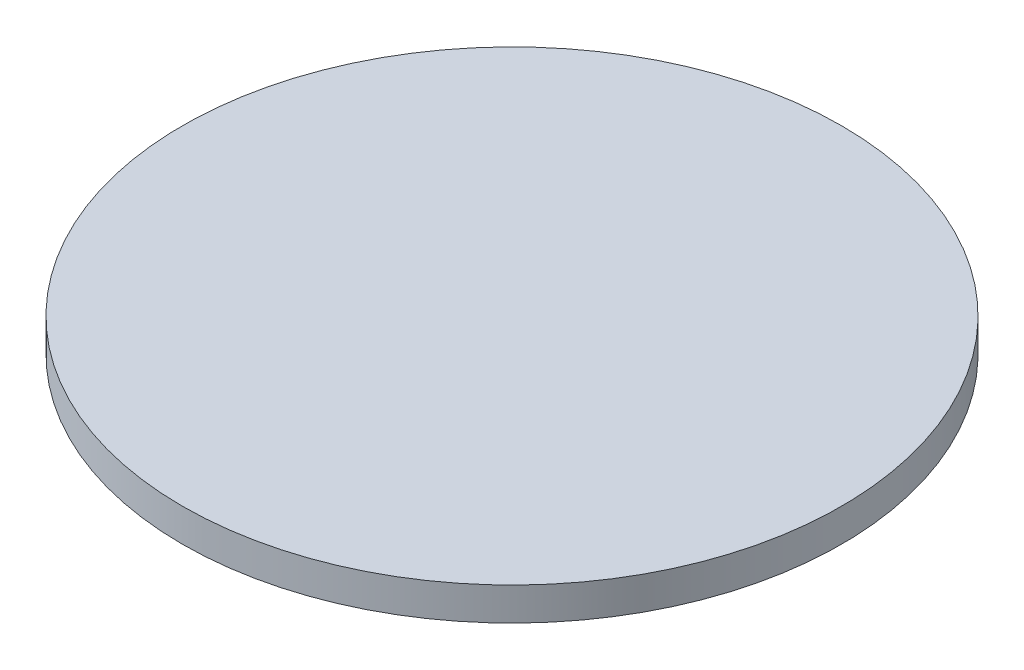
from build123d import *

# Parameters (mm, degrees)
EXTRUDE_1_DEPTH                      = 3
EXTRUDE_3_DEPTH                      = 8
CUT_EXTRUDE_3_DEPTH                  = 9
EXTRUDE_4_DEPTH                      = 3
EXTRUDE_START                        = -3
EXTRUDE_5_DEPTH                      = 3
CHAMFER_1_SIZE                       = 2
FILLET_1_R                           = 2
PATTERN_CIRCULAR_3_COUNT             = 3
PATTERN_CIRCULAR_3_COPY_1_DEPTH      = 9
PATTERN_CIRCULAR_3_COPY_2_DEPTH      = 9
CHAMFER_1_OF_PATTERN_CIRCULAR_3_SIZE = 2
FILLET_1_OF_PATTERN_CIRCULAR_3_R     = 2
SKETCH_8_R                           = 10
SKETCH_8_R_2                         = 7.5
EXTRUDE_6_DEPTH                      = 7
FILLET_2_R                           = 10
SKETCH_11_R                          = 100
EXTRUDE_7_DEPTH                      = 10


with BuildPart() as part:
    # 草圖1 → 填料-伸長1 (new body)
    with BuildSketch(Plane(origin=(0, 0, 0), x_dir=(1, 0, 0), z_dir=(0, 1, 0))):
        Polygon((0, 0), (-16.823237932, 62.785178709), (-62.785178709, -16.823237932), align=None)
        with BuildLine():
            Line((0, 65), (0, 0))
            Line((0, 0), (16.823237932, 62.785178709))
            ThreePointArc((16.823237932, 62.785178709), (8.484202494, 64.443915989), (0, 65))
        make_face()
        with BuildLine():
            Line((-16.823237932, 62.785178709), (0, 0))
            Line((0, 0), (0, 65))
            ThreePointArc((0, 65), (-8.484202494, 64.443915989), (-16.823237932, 62.785178709))
        make_face()
        Polygon((0, 0), (62.785178709, -16.823237932), (16.823237932, 62.785178709), align=None)
        with BuildLine():
            Line((0, 0), (45.961940777, -45.961940777))
            ThreePointArc((45.961940777, -45.961940777), (56.291651246, -32.5), (62.785178709, -16.823237932))
            Line((62.785178709, -16.823237932), (0, 0))
        make_face()
        Polygon((0, 0), (0, -45.961940777), (45.961940777, -45.961940777), align=None)
        Polygon((-45.961940777, -45.961940777), (0, -45.961940777), (0, 0), align=None)
        with BuildLine():
            Line((0, 0), (-62.785178709, -16.823237932))
            ThreePointArc((-62.785178709, -16.823237932), (-56.291651246, -32.5), (-45.961940777, -45.961940777))
            Line((-45.961940777, -45.961940777), (0, 0))
        make_face()
    extrude(amount=EXTRUDE_1_DEPTH)

    # 草圖2 → 填料-伸長3 (add)
    with BuildSketch(Plane.XZ):
        Polygon((12.862942044, -63.846336794), (20.783533819, -61.724020624), (18.195343368, -52.064762361), (10.274751593, -54.187078531), align=None)
        Polygon((-10.274751593, -54.187078531), (-18.195343368, -52.064762361), (-20.783533819, -61.724020624), (-12.862942044, -63.846336794), align=None)
    extrude_3 = extrude(amount=EXTRUDE_3_DEPTH)

    # 草圖5 → 除料-伸長3 (cut)
    with BuildSketch(Plane(origin=(16.823237932, 0, -62.785178709), x_dir=(-0.9659258262890813, 0, -0.2588190451024721), z_dir=(0.2588190451024721, 0, -0.9659258262890813))):
        with BuildLine():
            Line((0.1, -7.39411255), (1.797056275, -5.697056275))
            ThreePointArc((1.797056275, -5.697056275), (0.1, -1.6), (-1.597056275, -5.697056275))
            Line((-1.597056275, -5.697056275), (0.1, -7.39411255))
        make_face()
    cut_extrude_3 = extrude(amount=-CUT_EXTRUDE_3_DEPTH, mode=Mode.SUBTRACT)

    # 鏡射1: 除料-伸長3 across plane
    add(cut_extrude_3.mirror(Plane(origin=(0, 0, 0), x_dir=(0, 0, 1), z_dir=(1, 0, 0))), mode=Mode.SUBTRACT)

    # 草圖6 → 填料-伸長4 (add)
    with BuildSketch(Plane(origin=(0, 0, 0), x_dir=(1, 0, 0), z_dir=(0, 1, 0))):
        with BuildLine():
            ThreePointArc((12.829441395, 63.72131067), (14.83372622, 63.284757773), (16.823237932, 62.785178709))
            Line((16.823237932, 62.785178709), (12.862942044, 63.846336794))
            Line((12.862942044, 63.846336794), (12.829441395, 63.72131067))
        make_face()
        Polygon((20.783533819, 61.724020624), (16.823237932, 62.785178709), (19.722375735, 57.763724736), align=None)
        with BuildLine():
            Line((-12.829441395, 63.72131067), (-12.862942044, 63.846336794))
            Line((-12.862942044, 63.846336794), (-16.823237932, 62.785178709))
            ThreePointArc((-16.823237932, 62.785178709), (-14.83372622, 63.284757773), (-12.829441395, 63.72131067))
        make_face()
        Polygon((-19.722375735, 57.763724736), (-16.823237932, 62.785178709), (-20.783533819, 61.724020624), align=None)
    extrude_4 = extrude(amount=EXTRUDE_4_DEPTH)

    # 草圖7 → 填料-伸長5 (add)
    with BuildSketch(Plane(origin=(0, 3, 0), x_dir=(1, 0, 0), z_dir=(0, 1, 0)).offset(EXTRUDE_START)):
        with BuildLine():
            Line((12.829441395, 63.72131067), (12.862942044, 63.846336794))
            ThreePointArc((12.862942044, 63.846336794), (0.00408223, 65.129179201), (-12.854938297, 63.847948764))
            Line((-12.854938297, 63.847948764), (-12.829441395, 63.72131067))
            ThreePointArc((-12.829441395, 63.72131067), (0, 65), (12.829441395, 63.72131067))
        make_face()
    extrude_5 = extrude(amount=EXTRUDE_5_DEPTH)

    # 導角1
    # the kernel refuses this chamfer: 2 mm, written as the material it takes off along each edge
    with BuildSketch(Plane(origin=(7.894832014, -8, -65.177537864), x_dir=(-0.2587211899984849, -0.027495876610586514, 0.9655606260692197), z_dir=(0.9659258262890813, 0, 0.2588190451024725))) as chamfer_1_piece_1:
        Polygon((CHAMFER_1_SIZE * 0.999621916911, -CHAMFER_1_SIZE * 0.0274958766106), (-CHAMFER_1_SIZE * 0.0274958766106, -CHAMFER_1_SIZE * 0.999621916911), (0, 0), align=None)
    extrude(amount=18.486731952, mode=Mode.SUBTRACT)
    with BuildSketch(Plane(origin=(-25.75164385, -8, -60.392819553), x_dir=(-0.007116456528607307, 0.9996219169112968, -0.0265589773346234), z_dir=(0.9659258262890822, 0, -0.25881904510246906))) as chamfer_1_piece_2:
        Polygon((CHAMFER_1_SIZE * 0.999621916911, CHAMFER_1_SIZE * 0.0274958766106), (-CHAMFER_1_SIZE * 0.0274958766106, CHAMFER_1_SIZE * 0.999621916911), (0, 0), align=None)
    extrude(amount=18.486731952, mode=Mode.SUBTRACT)

    # 圓角1
    fillet_1_edges = [part.edges().sort_by_distance(p)[0] for p in [
        (-19.230619549, -8, -55.928465666),
        (-11.310027773, -8, -58.050781836),
        (11.310027773, -8, -58.050781836),
        (19.230619549, -8, -55.928465666),
    ]]
    fillet(fillet_1_edges, radius=FILLET_1_R)

    # 環狀複製排列3: 填料-伸長3, 除料-伸長3, 填料-伸長4, 填料-伸長5 ×3 about axis
    pattern_circular_3_axis = Axis((0, 0, 0), (0, 1, 0))
    add([extrude_3.rotate(pattern_circular_3_axis, i * 360 / PATTERN_CIRCULAR_3_COUNT) for i in range(1, PATTERN_CIRCULAR_3_COUNT)])
    add([cut_extrude_3.rotate(pattern_circular_3_axis, i * 360 / PATTERN_CIRCULAR_3_COUNT) for i in range(1, PATTERN_CIRCULAR_3_COUNT)], mode=Mode.SUBTRACT)
    add([extrude_4.rotate(pattern_circular_3_axis, i * 360 / PATTERN_CIRCULAR_3_COUNT) for i in range(1, PATTERN_CIRCULAR_3_COUNT)])
    add([extrude_5.rotate(pattern_circular_3_axis, i * 360 / PATTERN_CIRCULAR_3_COUNT) for i in range(1, PATTERN_CIRCULAR_3_COUNT)])

    # 環狀複製排列3 copy 1 sketch → 環狀複製排列3 copy 1 (cut)
    with BuildSketch(Plane(origin=(-45.961940777, 0, 45.961940777), x_dir=(-0.7071067811865117, 0, -0.7071067811865832), z_dir=(-0.7071067811865832, 0, 0.7071067811865117))):
        with BuildLine():
            Line((0.1, 7.39411255), (1.797056275, 5.697056275))
            ThreePointArc((1.797056275, 5.697056275), (0.1, 1.6), (-1.597056275, 5.697056275))
            Line((-1.597056275, 5.697056275), (0.1, 7.39411255))
        make_face()
    extrude(amount=-PATTERN_CIRCULAR_3_COPY_1_DEPTH, mode=Mode.SUBTRACT)

    # 環狀複製排列3 copy 2 sketch → 環狀複製排列3 copy 2 (cut)
    with BuildSketch(Plane(origin=(62.785178709, 0, 16.823237932), x_dir=(-0.2588190451025699, 0, 0.9659258262890551), z_dir=(0.9659258262890551, 0, 0.2588190451025699))):
        with BuildLine():
            Line((0.1, 7.39411255), (1.797056275, 5.697056275))
            ThreePointArc((1.797056275, 5.697056275), (0.1, 1.6), (-1.597056275, 5.697056275))
            Line((-1.597056275, 5.697056275), (0.1, 7.39411255))
        make_face()
    extrude(amount=-PATTERN_CIRCULAR_3_COPY_2_DEPTH, mode=Mode.SUBTRACT)

    # 導角1 of 環狀複製排列3
    # the kernel refuses this chamfer: 2 mm, written as the material it takes off along each edge
    with BuildSketch(Plane(origin=(-60.392819553, -8, 25.75164385), x_dir=(-0.026558977334623094, 0.9996219169112968, 0.007116456528610167), z_dir=(-0.25881904510256887, 0, -0.9659258262890554)), Plane(origin=(-39.425894015, -8, 52.49798754), x_dir=(-0.019442520806014836, 0.9996219169112968, 0.019442520806012744), z_dir=(-0.7071067811865095, 0, -0.7071067811865857)), Plane(origin=(52.49798754, -8, 39.425894015), x_dir=(0.01944252080601648, 0.9996219169112968, 0.01944252080601455), z_dir=(-0.7071067811865125, 0, 0.7071067811865825)), Plane(origin=(65.177537864, -8, 7.894832014), x_dir=(0.026558977334623382, 0.9996219169112965, 0.007116456528610366), z_dir=(-0.258819045102573, 0, 0.9659258262890543))) as chamfer_1_of_pattern_circular_3_piece_1:
        Polygon((CHAMFER_1_OF_PATTERN_CIRCULAR_3_SIZE * 0.999621916911, CHAMFER_1_OF_PATTERN_CIRCULAR_3_SIZE * 0.0274958766106), (-CHAMFER_1_OF_PATTERN_CIRCULAR_3_SIZE * 0.0274958766106, CHAMFER_1_OF_PATTERN_CIRCULAR_3_SIZE * 0.999621916911), (0, 0), align=None)
    extrude(amount=18.486731952, mode=Mode.SUBTRACT)

    # 圓角1 of 環狀複製排列3
    fillet_1_of_pattern_circular_3_edges = [part.edges().sort_by_distance(p)[0] for p in [
        (-38.820162287, -8, 44.618437893),
        (-44.618437893, -8, 38.820162287),
        (-55.928465666, -8, 19.230619549),
        (-58.050781836, -8, 11.310027773),
        (58.050781836, -8, 11.310027773),
        (55.928465666, -8, 19.230619549),
        (44.618437893, -8, 38.820162287),
        (38.820162287, -8, 44.618437893),
    ]]
    fillet(fillet_1_of_pattern_circular_3_edges, radius=FILLET_1_OF_PATTERN_CIRCULAR_3_R)

    # 草圖8 → 填料-伸長6 (add)
    # profile 1 of 7: a face of its own
    with BuildSketch(Plane.XZ):
        with BuildLine():
            Line((-39.774756442, 38.006989489), (-7.899491077, 6.131724124))
            ThreePointArc((-7.899491077, 6.131724124), (-7.071067812, 7.071067812), (-6.131724124, 7.899491077))
            Line((-6.131724124, 7.899491077), (-38.006989489, 39.774756442))
            Line((-38.006989489, 39.774756442), (-39.774756442, 38.006989489))
        make_face()
    # profile 2 of 7: a face of its own
    with BuildSketch(Plane.XZ):
        with BuildLine():
            Line((-53.449444252, 13.027640198), (-9.907022011, 1.360483322))
            ThreePointArc((-9.907022011, 1.360483322), (-9.659258263, 2.588190451), (-9.259974398, 3.775297888))
            Line((-9.259974398, 3.775297888), (-52.80239664, 15.442454763))
            Line((-52.80239664, 15.442454763), (-53.449444252, 13.027640198))
        make_face()
    # profile 3 of 7: a face of its own
    with BuildSketch(Plane.XZ):
        with BuildLine():
            ThreePointArc((6.131724124, 7.899491077), (7.071067812, 7.071067812), (7.899491077, 6.131724124))
            Line((7.899491077, 6.131724124), (39.774756442, 38.006989489))
            Line((39.774756442, 38.006989489), (38.006989489, 39.774756442))
            Line((38.006989489, 39.774756442), (6.131724124, 7.899491077))
        make_face()
    # profile 4 of 7: a face of its own
    with BuildSketch(Plane.XZ):
        with BuildLine():
            ThreePointArc((9.259974398, 3.775297888), (9.659258263, 2.588190451), (9.907022011, 1.360483322))
            Line((9.907022011, 1.360483322), (53.449444252, 13.027640198))
            Line((53.449444252, 13.027640198), (52.80239664, 15.442454764))
            Line((52.80239664, 15.442454764), (9.259974398, 3.775297888))
        make_face()
    # profile 5 of 7: a face of its own
    with BuildSketch(Plane.XZ):
        with BuildLine():
            Line((1.360483322, -9.907022011), (13.027640198, -53.449444252))
            Line((13.027640198, -53.449444252), (15.442454764, -52.80239664))
            Line((15.442454764, -52.80239664), (3.775297888, -9.259974398))
            ThreePointArc((3.775297888, -9.259974398), (2.588190451, -9.659258263), (1.360483322, -9.907022011))
        make_face()
    # profile 6 of 7: a face of its own
    with BuildSketch(Plane.XZ):
        with BuildLine():
            Line((-13.027640198, -53.449444252), (-1.360483322, -9.907022011))
            ThreePointArc((-1.360483322, -9.907022011), (-2.588190451, -9.659258263), (-3.775297888, -9.259974398))
            Line((-3.775297888, -9.259974398), (-15.442454763, -52.80239664))
            Line((-15.442454763, -52.80239664), (-13.027640198, -53.449444252))
        make_face()
    # profile 7 of 7: a face of its own
    with BuildSketch(Plane.XZ):
        Circle(SKETCH_8_R)
        with Locations(Location((0, 0, 0), (0, 0, 270))):
            Circle(SKETCH_8_R_2, mode=Mode.SUBTRACT)
    extrude(amount=EXTRUDE_6_DEPTH)

    # 圓角2
    # the kernel refuses this fillet: 10 mm, written as the material it adds along each edge
    with BuildSketch(Plane(origin=(-59.886040906, 0, 11.801783959), x_dir=(-0.9659258262890541, 0, 0.2588190451025734), z_dir=(0, 1, 0))) as fillet_2_piece_1_section:
        with BuildLine():
            CenterArc((FILLET_2_R * 0.414213562371, -FILLET_2_R), FILLET_2_R, 90, 45)
            Line((-FILLET_2_R * 0.292893218815, -FILLET_2_R * 0.292893218813), (0, 0))
            Line((0, 0), (FILLET_2_R * 0.414213562371, 0))
        make_face()
    fillet_2_piece_1 = extrude(amount=3, mode=Mode.PRIVATE)
    fillet_2_piece_1 = split(fillet_2_piece_1, bisect_by=Plane(origin=(-64.006723661, 1.5, 12.264370105), z_dir=(0.9659258262890554, 0, -0.25881904510256887)), keep=Keep.TOP, mode=Mode.PRIVATE)
    add(fillet_2_piece_1)
    with BuildSketch(Plane(origin=(-40.163665171, 0, 45.961940777), x_dir=(-0.707106781186538, 0, 0.7071067811865569), z_dir=(0, 1, 0))) as fillet_2_piece_2_section:
        with BuildLine():
            CenterArc((FILLET_2_R * 0.414213562373, FILLET_2_R), FILLET_2_R, 225, 45)
            Line((-FILLET_2_R * 0.292893218813, FILLET_2_R * 0.292893218813), (0, 0))
            Line((0, 0), (FILLET_2_R * 0.414213562373, 0))
        make_face()
    fillet_2_piece_2 = extrude(amount=3, mode=Mode.PRIVATE)
    fillet_2_piece_2 = split(fillet_2_piece_2, bisect_by=Plane(origin=(-42.624617903, 1.5, 49.299263651), z_dir=(0.7071067811878319, 0, -0.7071067811852634)), keep=Keep.TOP, mode=Mode.PRIVATE)
    add(fillet_2_piece_2)
    with BuildSketch(Plane(origin=(40.163665171, 0, 45.961940777), x_dir=(-1.0, 0, -1.1304498582404621e-12), z_dir=(0, 1, 0))) as fillet_2_piece_3_section:
        with BuildLine():
            CenterArc((FILLET_2_R * 0.414213562372, FILLET_2_R), FILLET_2_R, 225, 45)
            Line((-FILLET_2_R * 0.292893218814, FILLET_2_R * 0.292893218813), (0, 0))
            Line((0, 0), (FILLET_2_R * 0.414213562373, 0))
        make_face()
    fillet_2_piece_3 = extrude(amount=3, mode=Mode.PRIVATE)
    fillet_2_piece_3 = split(fillet_2_piece_3, bisect_by=Plane(origin=(42.624617903, 1.5, 49.299263651), z_dir=(-0.7071067811865825, 0, -0.7071067811865125)), keep=Keep.TOP, mode=Mode.PRIVATE)
    add(fillet_2_piece_3)
    with BuildSketch(Plane(origin=(59.886040906, 0, 11.801783959), x_dir=(0.9659258262890713, 0, 0.25881904510251014), z_dir=(0, 1, 0))) as fillet_2_piece_4_section:
        with BuildLine():
            CenterArc((FILLET_2_R * 0.414213562375, FILLET_2_R), FILLET_2_R, 225, 45)
            Line((-FILLET_2_R * 0.292893218812, FILLET_2_R * 0.292893218813), (0, 0))
            Line((0, 0), (FILLET_2_R * 0.414213562375, 0))
        make_face()
    fillet_2_piece_4 = extrude(amount=3, mode=Mode.PRIVATE)
    fillet_2_piece_4 = split(fillet_2_piece_4, bisect_by=Plane(origin=(64.006723661, 1.5, 12.264370105), z_dir=(-0.9659258262885981, 0, -0.2588190451042754)), keep=Keep.TOP, mode=Mode.PRIVATE)
    add(fillet_2_piece_4)
    with BuildSketch(Plane(origin=(19.722375735, 0, -57.763724736), x_dir=(0.49999999999999933, 0, 0.866025403784439), z_dir=(0, 1, 0))) as fillet_2_piece_5_section:
        with BuildLine():
            CenterArc((FILLET_2_R * 0.414213562373, FILLET_2_R), FILLET_2_R, 225, 45)
            Line((-FILLET_2_R * 0.292893218813, FILLET_2_R * 0.292893218813), (0, 0))
            Line((0, 0), (FILLET_2_R * 0.414213562373, 0))
        make_face()
    fillet_2_piece_5 = extrude(amount=3, mode=Mode.PRIVATE)
    fillet_2_piece_5 = split(fillet_2_piece_5, bisect_by=Plane(origin=(21.382105758, 1.5, -61.563633756), z_dir=(-0.2588190451024714, 0, 0.9659258262890816)), keep=Keep.TOP, mode=Mode.PRIVATE)
    add(fillet_2_piece_5)
    with BuildSketch(Plane(origin=(-19.722375735, 0, -57.763724736), x_dir=(-0.4999999999999984, 0, 0.8660254037844397), z_dir=(0, 1, 0))) as fillet_2_piece_6_section:
        with BuildLine():
            CenterArc((FILLET_2_R * 0.414213562373, -FILLET_2_R), FILLET_2_R, 90, 45)
            Line((-FILLET_2_R * 0.292893218813, -FILLET_2_R * 0.292893218813), (0, 0))
            Line((0, 0), (FILLET_2_R * 0.414213562373, 0))
        make_face()
    fillet_2_piece_6 = extrude(amount=3, mode=Mode.PRIVATE)
    fillet_2_piece_6 = split(fillet_2_piece_6, bisect_by=Plane(origin=(-21.382105758, 1.5, -61.563633756), z_dir=(0.25881904510246906, 0, 0.9659258262890822)), keep=Keep.TOP, mode=Mode.PRIVATE)
    add(fillet_2_piece_6)

    # 草圖11 → 填料-伸長7 (add)
    with BuildSketch(Plane(origin=(0, 3, 0), x_dir=(1, 0, 0), z_dir=(0, 1, 0))):
        with Locations(Location((0, 0, 0), (0, 0, 270))):
            Circle(SKETCH_11_R)
    extrude(amount=EXTRUDE_7_DEPTH)


solid = part.part
